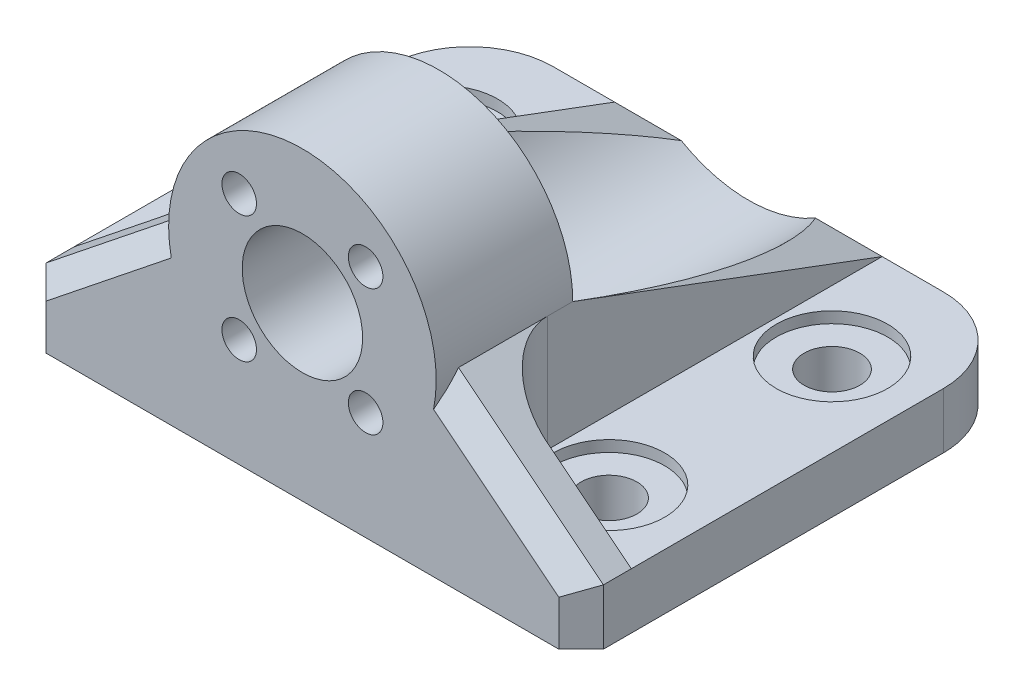
from build123d import *

# Parameters (mm, degrees)
BOSS_EXTRUDE1_DEPTH           = 5
SKETCH2_R                     = 12
SKETCH2_R_2                   = 5.4
SKETCH2_R_3                   = 1.55
BOSS_EXTRUDE2_DEPTH           = 12.25
BOSS_EXTRUDE3_DEPTH           = 4.5
CHAMFER1_SIZE                 = 2
BOSS_EXTRUDE4_DEPTH           = 24
SKETCH5_R                     = 5.4
SKETCH5_R_2                   = 1.55
CUT_EXTRUDE1_DEPTH            = 70.639531877
CUT_EXTRUDE2_START            = -27.75
SKETCH6_R                     = 12
CUT_EXTRUDE2_DEPTH            = 27.75
FILLET1_R                     = 5.5
BOSS_EXTRUDE5_DEPTH           = 1
BOSS_EXTRUDE5_DRAFT           = 45
SKETCH7_W                     = 50
SKETCH7_H                     = 9
BOSS_EXTRUDE5_PROFILE_2_DEPTH = 1
BOSS_EXTRUDE5_PROFILE_2_DRAFT = 45
SKETCH8_R                     = 2.5
CUT_EXTRUDE3_DEPTH            = 71.038734997
SKETCH9_R                     = 5
CUT_EXTRUDE4_DEPTH            = 1


with BuildPart() as part:
    # Sketch1 → Boss-Extrude1 (new body)
    with BuildSketch(Plane(origin=(0, 0, 0), x_dir=(1, 0, 0), z_dir=(0, 1, 0))):
        with BuildLine():
            Line((0, 2), (2, 0))
            Line((2, 0), (48, 0))
            Line((48, 0), (50, 2))
            Line((50, 2), (50, 32.5))
            ThreePointArc((50, 32.5), (47.803300859, 37.803300859), (42.5, 40))
            Line((42.5, 40), (7.5, 40))
            ThreePointArc((7.5, 40), (2.196699141, 37.803300859), (0, 32.5))
            Line((0, 32.5), (0, 2))
        make_face()
    extrude(amount=BOSS_EXTRUDE1_DEPTH)

    # Sketch2 → Boss-Extrude2 (add)
    with BuildSketch(Plane.XY):
        with Locations((25, 15.38)):
            Circle(SKETCH2_R)
        with Locations((25, 15.38)):
            Circle(SKETCH2_R_2, mode=Mode.SUBTRACT)
        with Locations((19.33, 21.05)):
            Circle(SKETCH2_R_3, mode=Mode.SUBTRACT)
        with Locations(Location((30.67, 21.05, 0), (0, 0, 180))):
            Circle(SKETCH2_R_3, mode=Mode.SUBTRACT)
        with Locations((30.67, 9.71)):
            Circle(SKETCH2_R_3, mode=Mode.SUBTRACT)
        with Locations(Location((19.33, 9.71, 0), (0, 0, 180))):
            Circle(SKETCH2_R_3, mode=Mode.SUBTRACT)
    extrude(amount=-BOSS_EXTRUDE2_DEPTH)

    # Sketch3 → Boss-Extrude3 (add)
    with BuildSketch(Plane.XY):
        with BuildLine():
            Line((13, 15.38), (0, 5))
            Line((0, 5), (18.978737674, 5))
            ThreePointArc((18.978737674, 5), (14.601559061, 9.390640598), (13, 15.38))
        make_face()
        with BuildLine():
            Line((50, 5), (31.021262326, 5))
            ThreePointArc((31.021262326, 5), (35.398440939, 9.390640598), (37, 15.38))
            Line((37, 15.38), (50, 5))
        make_face()
    extrude(amount=-BOSS_EXTRUDE3_DEPTH)

    # Chamfer1
    # the kernel refuses this chamfer: 2 mm, written as the material it takes off along each edge
    with BuildSketch(Plane(origin=(32.980691337, 18.589263379, 0), x_dir=(-0.6237257907466237, -0.7811594681797787, 0.027495876610586348), z_dir=(0.7814549230707756, -0.6239617001134351, 0))) as chamfer1_piece_1_section:
        Polygon((CHAMFER1_SIZE * 0.999621916911, CHAMFER1_SIZE * 0.0274958766106), (-CHAMFER1_SIZE * 0.0274958766106, CHAMFER1_SIZE * 0.999621916911), (0, 0), align=None)
    chamfer1_piece_1 = extrude(amount=26.922368399, mode=Mode.PRIVATE)
    chamfer1_piece_1 = chamfer1_piece_1 - Plane(origin=(25, 15.38, -0.663889937), x_dir=(1, 0, 0), z_dir=(0, 0, 1)) * Cylinder(12, 62, mode=Mode.PRIVATE)
    add(chamfer1_piece_1, mode=Mode.SUBTRACT)
    with BuildSketch(Plane(origin=(17.019308663, 18.589263379, 0), x_dir=(-0.017156373916051248, 0.02148678814149, -0.9996219169112968), z_dir=(-0.7814549230707758, -0.6239617001134349, 0))) as chamfer1_piece_2_section:
        Polygon((CHAMFER1_SIZE * 0.999621916911, CHAMFER1_SIZE * 0.0274958766106), (-CHAMFER1_SIZE * 0.0274958766106, CHAMFER1_SIZE * 0.999621916911), (0, 0), align=None)
    chamfer1_piece_2 = extrude(amount=26.922368399, mode=Mode.PRIVATE)
    chamfer1_piece_2 = chamfer1_piece_2 - Plane(origin=(25, 15.38, -0.663889938), x_dir=(1, 0, 0), z_dir=(0, 0, 1)) * Cylinder(12, 62, mode=Mode.PRIVATE)
    add(chamfer1_piece_2, mode=Mode.SUBTRACT)

    # Sketch4 → Boss-Extrude4 (add)
    with BuildSketch(Plane.ZY.offset(-13)):
        Polygon((-40, 5), (-4.5, 5), (-4.5, 15.38), (-12.25, 15.38), align=None)
    extrude(amount=-BOSS_EXTRUDE4_DEPTH)

    # Sketch5 → Cut-Extrude1 (cut, through all)
    with BuildSketch(Plane.XY):
        with Locations((25, 15.38)):
            Circle(SKETCH5_R)
        with Locations((30.67, 9.71)):
            Circle(SKETCH5_R_2)
        with Locations(Location((19.33, 9.71, 0), (0, 0, 90))):
            Circle(SKETCH5_R_2)
    extrude(amount=-CUT_EXTRUDE1_DEPTH, mode=Mode.SUBTRACT)

    # Sketch6 → Cut-Extrude2 (cut)
    with BuildSketch(Plane(origin=(0, 0, -40), x_dir=(-1, 0, 0), z_dir=(0, 0, -1)).offset(CUT_EXTRUDE2_START)):
        with Locations((-25, 15.38)):
            Circle(SKETCH6_R)
    extrude(amount=CUT_EXTRUDE2_DEPTH, mode=Mode.SUBTRACT)

    # Fillet1
    # the kernel refuses this fillet: 5.5 mm, written as the material it adds along each edge
    with BuildSketch(Plane(origin=(13, 5, -4.5), x_dir=(0, 0, -1), z_dir=(0, 1, 0))) as fillet1_piece_1_section:
        with BuildLine():
            CenterArc((FILLET1_R, FILLET1_R), FILLET1_R, 180, 90)
            Line((0, FILLET1_R), (0, 0))
            Line((0, 0), (FILLET1_R, 0))
        make_face()
    fillet1_piece_1 = extrude(amount=24.13, mode=Mode.PRIVATE)
    fillet1_piece_1 = split(fillet1_piece_1, bisect_by=Plane(origin=(9.562905038, 12.635611869, -5.815830527), z_dir=(0.6239617001134349, -0.7814549230707758, 0)), keep=Keep.TOP, mode=Mode.PRIVATE)
    add(fillet1_piece_1)
    with BuildSketch(Plane(origin=(37, 5, -4.5), x_dir=(1, 0, 0), z_dir=(0, 1, 0))) as fillet1_piece_2_section:
        with BuildLine():
            CenterArc((FILLET1_R, FILLET1_R), FILLET1_R, 180, 90)
            Line((0, FILLET1_R), (0, 0))
            Line((0, 0), (FILLET1_R, 0))
        make_face()
    fillet1_piece_2 = extrude(amount=24.13, mode=Mode.PRIVATE)
    fillet1_piece_2 = split(fillet1_piece_2, bisect_by=Plane(origin=(40.437094962, 12.635611869, -5.815830527), z_dir=(-0.6239617001134351, -0.7814549230707756, 0)), keep=Keep.TOP, mode=Mode.PRIVATE)
    add(fillet1_piece_2)


with BuildPart() as boss_extrude5_tool:
    # Sketch7 → Boss-Extrude5 (with draft: the straight prism first)
    with BuildSketch(Plane.XZ):
        with BuildLine():
            Line((0, -25.5), (0, -32.5))
            ThreePointArc((0, -32.5), (0.068206101, -33.509177609), (0.271583853, -34.5))
            Line((0.271583853, -34.5), (49.728416147, -34.5))
            ThreePointArc((49.728416147, -34.5), (49.931793899, -33.509177609), (50, -32.5))
            Line((50, -32.5), (50, -25.5))
            Line((50, -25.5), (0, -25.5))
        make_face()
    extrude(amount=BOSS_EXTRUDE5_DEPTH)
    # Boss-Extrude5: the draft: its side faces are tilted about the plane it starts from
    boss_extrude5_sides = [boss_extrude5_tool.faces().sort_by_distance(p)[0] for p in [
        (0, -0.5, -29),
        (0.068206101, -0.5, -33.509177609),
        (25, -0.5, -34.5),
        (49.931793899, -0.5, -33.509177609),
        (50, -0.5, -29),
        (25, -0.5, -25.5),
    ]]
    draft(boss_extrude5_sides, Plane.XZ, BOSS_EXTRUDE5_DRAFT)


with BuildPart() as part_1:
    add(part.part)

    # Boss-Extrude5: add boss_extrude5_tool
    add(boss_extrude5_tool.part)


with BuildPart() as boss_extrude5_profile_2_tool:
    # Sketch7 → Boss-Extrude5 profile 2 (with draft: the straight prism first)
    with BuildSketch(Plane.XZ):
        with Locations((25, -10)):
            Rectangle(SKETCH7_W, SKETCH7_H)
    extrude(amount=BOSS_EXTRUDE5_PROFILE_2_DEPTH)
    # Boss-Extrude5 profile 2: the draft: its side faces are tilted about the plane it starts from
    boss_extrude5_profile_2_sides = [boss_extrude5_profile_2_tool.faces().sort_by_distance(p)[0] for p in [
        (0, -0.5, -10),
        (25, -0.5, -14.5),
        (50, -0.5, -10),
        (25, -0.5, -5.5),
    ]]
    draft(boss_extrude5_profile_2_sides, Plane.XZ, BOSS_EXTRUDE5_PROFILE_2_DRAFT)


with BuildPart() as part_2:
    add(part_1.part)

    # Boss-Extrude5 profile 2: add boss_extrude5_profile_2_tool
    add(boss_extrude5_profile_2_tool.part)

    # Sketch8 → Cut-Extrude3 (cut, through all)
    with BuildSketch(Plane.XZ.offset(1)):
        with Locations(Location((7.5, -30, 0), (0, 0, 270))):
            Circle(SKETCH8_R)
        with Locations(Location((42.5, -30, 0), (0, 0, 270))):
            Circle(SKETCH8_R)
        with Locations(Location((42.5, -10, 0), (0, 0, 270))):
            Circle(SKETCH8_R)
        with Locations(Location((7.5, -10, 0), (0, 0, 270))):
            Circle(SKETCH8_R)
    extrude(amount=-CUT_EXTRUDE3_DEPTH, mode=Mode.SUBTRACT)

    # Sketch9 → Cut-Extrude4 (cut)
    with BuildSketch(Plane(origin=(0, 5, 0), x_dir=(1, 0, 0), z_dir=(0, 1, 0))):
        with Locations(Location((7.5, 30, 0), (0, 0, 270))):
            Circle(SKETCH9_R)
        with Locations(Location((7.5, 10, 0), (0, 0, 270))):
            Circle(SKETCH9_R)
        with Locations(Location((42.5, 30, 0), (0, 0, 270))):
            Circle(SKETCH9_R)
        with Locations(Location((42.5, 10, 0), (0, 0, 270))):
            Circle(SKETCH9_R)
    extrude(amount=-CUT_EXTRUDE4_DEPTH, mode=Mode.SUBTRACT)


solid = part_2.part
